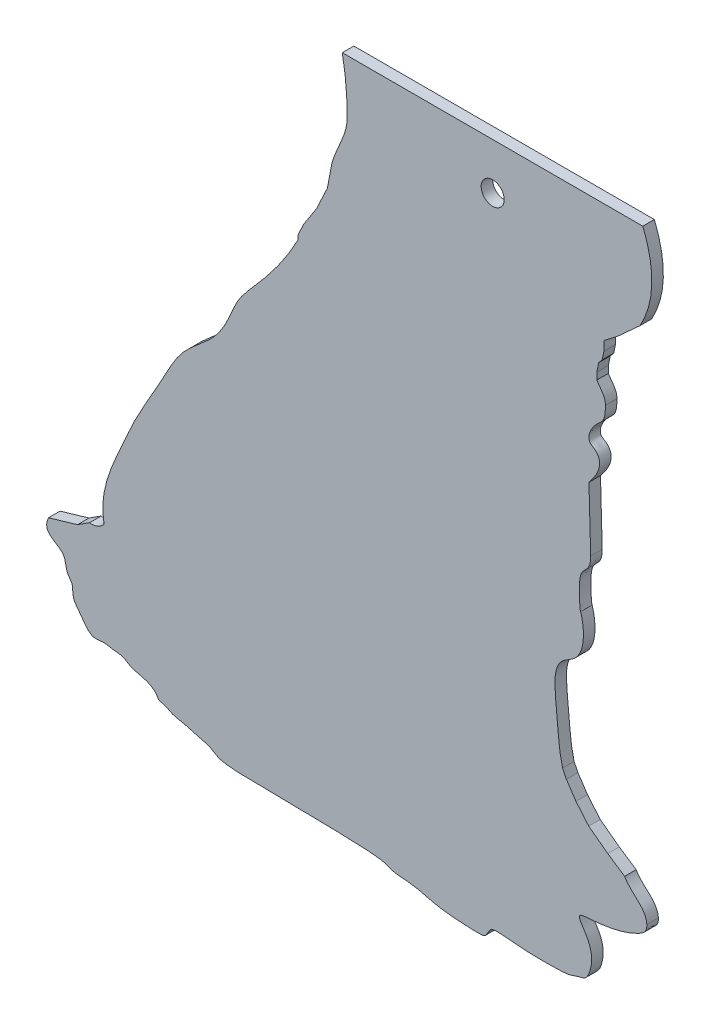
from build123d import *

# Parameters (mm, degrees)
SKETCH1_R           = 3.175
BOSS_EXTRUDE2_DEPTH = 3.175


with BuildPart() as part:
    # Sketch1 → Boss-Extrude2 (new body)
    with BuildSketch(Plane.XY):
        with BuildLine():
            Line((167.202192931, 42.201207676), (162.551708352, 45.309526764))
            Line((162.551708352, 45.309526764), (157.314695785, 49.223337881))
            Line((157.314695785, 49.223337881), (153.792941224, 53.393644073))
            Line((153.792941224, 53.393644073), (151.178747268, 57.312700692))
            Line((151.178747268, 57.312700692), (150.112611404, 59.463302564))
            add(Edge.make_bspline(
                [(150.112611404, 59.463302564), (148.956776361, 63.836980097), (148.948583694, 71.439405876), (146.850507307, 84.051422667), (156.469353715, 88.150203705), (156.247504434, 95.51023866), (155.085269681, 99.2555556)],
                knots=[0, 0, 0, 0, 0.30878338, 0.618237109, 0.70440559, 1, 1, 1, 1], degree=3))
            add(Edge.make_bspline(
                [(157.85398611, 113.880538491), (157.856396998, 113.869859914), (157.850620297, 110.688002063), (155.308060719, 109.384630599), (154.418838948, 105.053269567), (154.8695522, 99.483416676), (155.085269681, 99.2555556)],
                knots=[0, 0, 0, 0, 0.124798805, 0.365607846, 0.555267038, 1, 1, 1, 1], degree=3))
            Line((157.85398611, 113.880538491), (157.37548461, 131.229540091))
            add(Edge.make_bspline(
                [(161.892659898, 151.807216677), (161.91251897, 149.031337188), (161.449944322, 147.791607901), (158.445100345, 145.385958906), (156.130886371, 141.380315264), (158.830222147, 140.043511959), (161.648730322, 137.407909117), (159.459654716, 133.727674066), (157.37548461, 131.229540091)],
                knots=[0, 0, 0, 0, 0.190659477, 0.228612673, 0.488802546, 0.534056192, 0.585175937, 1, 1, 1, 1], degree=3))
            add(Edge.make_bspline(
                [(159.534362736, 156.659486678), (160.786697559, 154.839870961), (162.005548182, 153.612430632), (161.892659898, 151.807216677)],
                knots=[0, 0, 0, 0, 1, 1, 1, 1], degree=3))
            Line((159.534362736, 156.659486678), (159.534362736, 158.498026385))
            Line((159.534362736, 158.498026385), (160.082455849, 161.112276627))
            Line((160.082455849, 161.112276627), (161.024283069, 162.24246929))
            Line((161.024283069, 162.24246929), (161.51276424, 164.572387305))
            Line((161.51276424, 164.572387305), (161.51276424, 167.102297744))
            Line((161.51276424, 167.102297744), (165.183542032, 169.901250177))
            Line((165.183542032, 169.901250177), (171.472031107, 175.621746691))
            add(Edge.make_bspline(
                [(172.196352762, 199.687728108), (177.512545782, 186.611864968), (171.472031107, 175.621746691)],
                knots=[0, 0, 0, 1, 1, 1], degree=2))
            Line((172.196352762, 199.687728108), (89.47301913, 199.687728108))
            add(Edge.make_bspline(
                [(89.47301913, 199.687728108), (90.449698127, 194.83749072), (90.825955315, 189.837761557), (90.838257386, 180.280743918), (87.678298822, 176.191377166), (86.590775441, 171.767770411)],
                knots=[0, 0, 0, 0, 0.517811069, 0.520823107, 1, 1, 1, 1], degree=3))
            Line((86.590775441, 171.767770411), (85.388246292, 165.381063893))
            Line((85.388246292, 165.381063893), (82.402306125, 158.982620678))
            Line((82.402306125, 158.982620678), (78.826589302, 153.432528352))
            Line((78.826589302, 153.432528352), (77.30963174, 150.181905003))
            Line((77.30963174, 150.181905003), (77.30963174, 148.972997238))
            add(Edge.make_bspline(
                [(23.904060298, 54.499744977), (22.54196001, 62.044422938), (27.151157223, 71.719882884), (33.171565612, 85.673583344), (39.470341202, 95.744406946), (45.044436084, 107.397118431), (54.154773918, 113.07293548), (58.357878564, 120.674742163), (60.641830631, 126.791490456), (68.416588167, 135.274765788), (73.920776574, 142.489426767), (77.30963174, 148.972997238)],
                knots=[0, 0, 0, 0, 0.194457475, 0.285904466, 0.412663627, 0.517827397, 0.629268786, 0.691338637, 0.750377013, 0.804905464, 1, 1, 1, 1], degree=3))
            add(Edge.make_bspline(
                [(19.90471503, 52.852955749), (22.437142387, 52.608313662), (23.904060298, 54.499744977)],
                knots=[0, 0, 0, 1, 1, 1], degree=2))
            Line((19.90471503, 52.852955749), (16.611136574, 50.735655313))
            Line((16.611136574, 50.735655313), (8.612446038, 48.383099273))
            add(Edge.make_bspline(
                [(8.612446038, 48.383099273), (6.569110394, 43.962826835), (13.647787757, 43.729648821), (13.25353988, 37.991488936), (15.22587651, 36.112808324), (15.244510931, 34.207409749), (15.425694449, 32.409220236), (16.98119857, 30.317149701), (18.454955258, 28.208570124), (20.727276999, 25.608877763), (23.640354073, 26.519579017), (26.378802415, 25.704997487), (29.007712932, 25.794951803), (31.225977748, 24.007852384), (34.946801718, 23.349304233), (38.00066538, 22.222153794), (38.883062856, 20.144990847)],
                knots=[0, 0, 0, 0, 0.185719976, 0.273851295, 0.320038418, 0.350192261, 0.393849297, 0.435550567, 0.514834292, 0.569194905, 0.638873602, 0.687586559, 0.755837415, 0.80106818, 0.86555143, 1, 1, 1, 1], degree=3))
            add(Edge.make_bspline(
                [(38.883062856, 20.144990847), (41.287485761, 19.565633761), (42.345781106, 18.507338416), (45.419877108, 18.154573301), (49.753848521, 16.793907858), (52.777549507, 16.18916766), (54.793350164, 14.828502217), (56.355595674, 14.173367003), (60.135221906, 13.770206872), (61.546282366, 13.770206872), (99.241754657, 13.215861691), (101.285601848, 12.223202762), (103.959367113, 11.297668631), (106.324621001, 11.297668631), (111.569314404, 10.577808752), (115.168613799, 9.24092612), (123.909769472, 8.521066241), (128.023254495, 8.521066241), (128.948788625, 8.726740492), (129.97715988, 10.783483004), (131.005531136, 11.811854259), (139.335338307, 10.783483004), (144.785705962, 10.783483004), (151.984304751, 10.783483004), (154.349558639, 12.120365636), (156.714812527, 12.120365636), (158.154532285, 16.028176407), (158.154532285, 19.318964425), (157.331835281, 21.684218313), (156.40630115, 23.329612322), (153.732535886, 27.134585968), (157.318908473, 27.134585968), (163.062883757, 27.775503981), (167.439245879, 28.924299038), (170.393290311, 30.100446358), (172.444710055, 31.285711099), (173.20373536, 32.322817748), (173.319982479, 33.191252106), (173.319982479, 33.793001898)],
                knots=[0, 0, 0, 0, 0.028571429, 0.057142857, 0.085714286, 0.114285714, 0.142857143, 0.171428571, 0.2, 0.228571429, 0.257142857, 0.285714286, 0.314285714, 0.342857143, 0.371428571, 0.4, 0.428571429, 0.457142857, 0.485714286, 0.514285714, 0.542857143, 0.571428571, 0.6, 0.628571429, 0.657142857, 0.685714286, 0.714285714, 0.742857143, 0.771428571, 0.8, 0.828571429, 0.857142857, 0.885714286, 0.914285714, 0.942857143, 0.971428571, 0.985714286, 1, 1, 1, 1], degree=3))
            add(Edge.make_bspline(
                [(173.319982479, 33.793001898), (173.056351571, 37.626592871), (168.840626644, 39.112234918), (167.202192931, 42.201207676)],
                knots=[0, 0, 0, 0, 1, 1, 1, 1], degree=3))
        make_face()
        with Locations((130.872154182, 186.924213923)):
            Circle(SKETCH1_R, mode=Mode.SUBTRACT)
    extrude(amount=BOSS_EXTRUDE2_DEPTH)


solid = part.part
